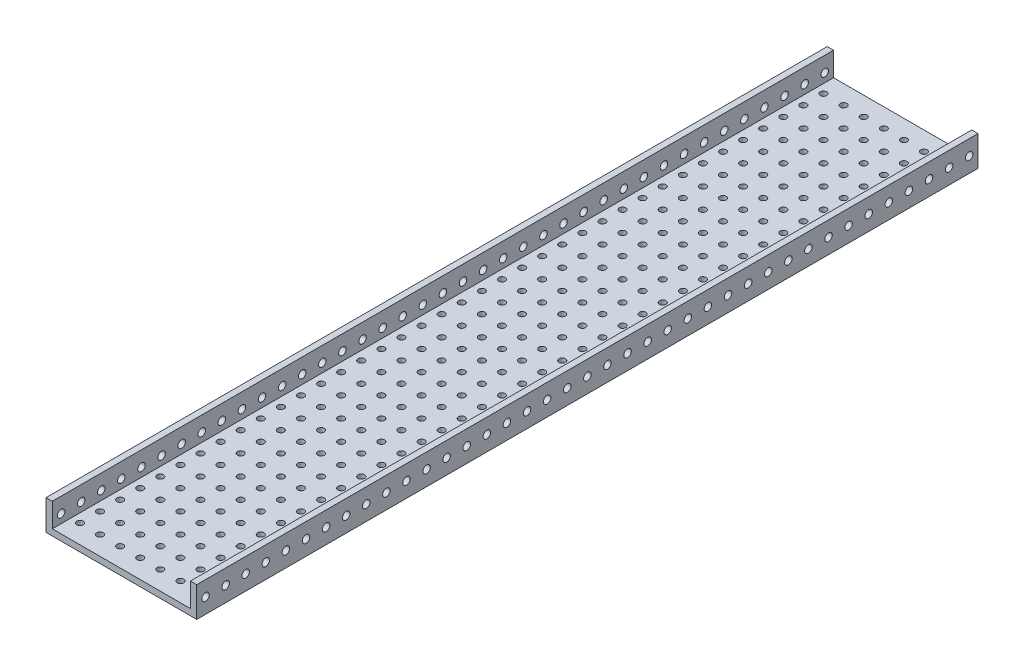
from build123d import *

# Parameters (mm, degrees)
EXTRUDE1_DEPTH        = 197.485
F_6_CLEARANCE_HOLE1_D = 3.7973
LPATTERN1_COUNT       = 39
LPATTERN1_PITCH       = 10.16
F_4_CLEARANCE_HOLE1_D = 3.2639
LPATTERN2_COUNT       = 4
LPATTERN2_PITCH       = 10.16
LPATTERN2_COL_COUNT   = 4
LPATTERN2_COL_PITCH   = 10.16
LPATTERN3_COUNT       = 38
LPATTERN3_PITCH       = 10.16
LPATTERN3_COPY_1_D    = 3.2639
LPATTERN3_COPY_2_D    = 3.2639
LPATTERN3_COPY_3_D    = 3.2639
LPATTERN3_COPY_4_D    = 3.2639
LPATTERN3_COPY_5_D    = 3.2639
LPATTERN3_COPY_6_D    = 3.2639
LPATTERN3_COPY_7_D    = 3.2639
LPATTERN3_COPY_8_D    = 3.2639
LPATTERN3_COPY_9_D    = 3.2639
LPATTERN3_COPY_10_D   = 3.2639
LPATTERN3_COPY_11_D   = 3.2639
LPATTERN3_COPY_12_D   = 3.2639
LPATTERN3_COPY_13_D   = 3.2639
LPATTERN3_COPY_14_D   = 3.2639
LPATTERN3_COPY_15_D   = 3.2639
LPATTERN3_COPY_16_D   = 3.2639
LPATTERN3_COPY_17_D   = 3.2639
LPATTERN3_COPY_18_D   = 3.2639
LPATTERN3_COPY_19_D   = 3.2639
LPATTERN3_COPY_20_D   = 3.2639
LPATTERN3_COPY_21_D   = 3.2639
LPATTERN3_COPY_22_D   = 3.2639
LPATTERN3_COPY_23_D   = 3.2639
LPATTERN3_COPY_24_D   = 3.2639
LPATTERN3_COPY_25_D   = 3.2639
LPATTERN3_COPY_26_D   = 3.2639
LPATTERN3_COPY_27_D   = 3.2639
LPATTERN3_COPY_28_D   = 3.2639
LPATTERN3_COPY_29_D   = 3.2639
LPATTERN3_COPY_30_D   = 3.2639
LPATTERN3_COPY_31_D   = 3.2639
LPATTERN3_COPY_32_D   = 3.2639
LPATTERN3_COPY_33_D   = 3.2639
LPATTERN3_COPY_34_D   = 3.2639
LPATTERN3_COPY_35_D   = 3.2639
LPATTERN3_COPY_36_D   = 3.2639
LPATTERN3_COPY_37_D   = 3.2639
LPATTERN3_COPY_38_D   = 3.2639
LPATTERN3_COPY_39_D   = 3.2639
LPATTERN3_COPY_40_D   = 3.2639
LPATTERN3_COPY_41_D   = 3.2639
LPATTERN3_COPY_42_D   = 3.2639
LPATTERN3_COPY_43_D   = 3.2639
LPATTERN3_COPY_44_D   = 3.2639
LPATTERN3_COPY_45_D   = 3.2639
LPATTERN3_COPY_46_D   = 3.2639
LPATTERN3_COPY_47_D   = 3.2639
LPATTERN3_COPY_48_D   = 3.2639
LPATTERN3_COPY_49_D   = 3.2639
LPATTERN3_COPY_50_D   = 3.2639
LPATTERN3_COPY_51_D   = 3.2639
LPATTERN3_COPY_52_D   = 3.2639
LPATTERN3_COPY_53_D   = 3.2639
LPATTERN3_COPY_54_D   = 3.2639
LPATTERN3_COPY_55_D   = 3.2639
LPATTERN3_COPY_56_D   = 3.2639
LPATTERN3_COPY_57_D   = 3.2639
LPATTERN3_COPY_58_D   = 3.2639
LPATTERN3_COPY_59_D   = 3.2639
LPATTERN3_COPY_60_D   = 3.2639
LPATTERN3_COPY_61_D   = 3.2639
LPATTERN3_COPY_62_D   = 3.2639
LPATTERN3_COPY_63_D   = 3.2639
LPATTERN3_COPY_64_D   = 3.2639
LPATTERN3_COPY_65_D   = 3.2639
LPATTERN3_COPY_66_D   = 3.2639
LPATTERN3_COPY_67_D   = 3.2639
LPATTERN3_COPY_68_D   = 3.2639
LPATTERN3_COPY_69_D   = 3.2639
LPATTERN3_COPY_70_D   = 3.2639
LPATTERN3_COPY_71_D   = 3.2639
LPATTERN3_COPY_72_D   = 3.2639
LPATTERN3_COPY_73_D   = 3.2639
LPATTERN3_COPY_74_D   = 3.2639
LPATTERN3_COPY_75_D   = 3.2639
LPATTERN3_COPY_76_D   = 3.2639
LPATTERN3_COPY_77_D   = 3.2639
LPATTERN3_COPY_78_D   = 3.2639
LPATTERN3_COPY_79_D   = 3.2639
LPATTERN3_COPY_80_D   = 3.2639
LPATTERN3_COPY_81_D   = 3.2639
LPATTERN3_COPY_82_D   = 3.2639
LPATTERN3_COPY_83_D   = 3.2639
LPATTERN3_COPY_84_D   = 3.2639
LPATTERN3_COPY_85_D   = 3.2639
LPATTERN3_COPY_86_D   = 3.2639
LPATTERN3_COPY_87_D   = 3.2639
LPATTERN3_COPY_88_D   = 3.2639
LPATTERN3_COPY_89_D   = 3.2639
LPATTERN3_COPY_90_D   = 3.2639
LPATTERN3_COPY_91_D   = 3.2639
LPATTERN3_COPY_92_D   = 3.2639
LPATTERN3_COPY_93_D   = 3.2639
LPATTERN3_COPY_94_D   = 3.2639
LPATTERN3_COPY_95_D   = 3.2639
LPATTERN3_COPY_96_D   = 3.2639
LPATTERN3_COPY_97_D   = 3.2639
LPATTERN3_COPY_98_D   = 3.2639
LPATTERN3_COPY_99_D   = 3.2639
LPATTERN3_COPY_100_D  = 3.2639
LPATTERN3_COPY_101_D  = 3.2639
LPATTERN3_COPY_102_D  = 3.2639
LPATTERN3_COPY_103_D  = 3.2639
LPATTERN3_COPY_104_D  = 3.2639
LPATTERN3_COPY_105_D  = 3.2639
LPATTERN3_COPY_106_D  = 3.2639
LPATTERN3_COPY_107_D  = 3.2639
LPATTERN3_COPY_108_D  = 3.2639
LPATTERN3_COPY_109_D  = 3.2639
LPATTERN3_COPY_110_D  = 3.2639
LPATTERN3_COPY_111_D  = 3.2639
LPATTERN3_COPY_112_D  = 3.2639
LPATTERN3_COPY_113_D  = 3.2639
LPATTERN3_COPY_114_D  = 3.2639
LPATTERN3_COPY_115_D  = 3.2639
LPATTERN3_COPY_116_D  = 3.2639
LPATTERN3_COPY_117_D  = 3.2639
LPATTERN3_COPY_118_D  = 3.2639
LPATTERN3_COPY_119_D  = 3.2639
LPATTERN3_COPY_120_D  = 3.2639
LPATTERN3_COPY_121_D  = 3.2639
LPATTERN3_COPY_122_D  = 3.2639
LPATTERN3_COPY_123_D  = 3.2639
LPATTERN3_COPY_124_D  = 3.2639
LPATTERN3_COPY_125_D  = 3.2639
LPATTERN3_COPY_126_D  = 3.2639
LPATTERN3_COPY_127_D  = 3.2639
LPATTERN3_COPY_128_D  = 3.2639
LPATTERN3_COPY_129_D  = 3.2639
LPATTERN3_COPY_130_D  = 3.2639
LPATTERN3_COPY_131_D  = 3.2639
LPATTERN3_COPY_132_D  = 3.2639
LPATTERN3_COPY_133_D  = 3.2639
LPATTERN3_COPY_134_D  = 3.2639
LPATTERN3_COPY_135_D  = 3.2639
LPATTERN3_COPY_136_D  = 3.2639
LPATTERN3_COPY_137_D  = 3.2639
LPATTERN3_COPY_138_D  = 3.2639
LPATTERN3_COPY_139_D  = 3.2639
LPATTERN3_COPY_140_D  = 3.2639
LPATTERN3_COPY_141_D  = 3.2639
LPATTERN3_COPY_142_D  = 3.2639
LPATTERN3_COPY_143_D  = 3.2639
LPATTERN3_COPY_144_D  = 3.2639
LPATTERN3_COPY_145_D  = 3.2639
LPATTERN3_COPY_146_D  = 3.2639
LPATTERN3_COPY_147_D  = 3.2639
LPATTERN3_COPY_148_D  = 3.2639
LPATTERN3_COPY_149_D  = 3.2639
LPATTERN3_COPY_150_D  = 3.2639
LPATTERN3_COPY_151_D  = 3.2639
LPATTERN3_COPY_152_D  = 3.2639
LPATTERN3_COPY_153_D  = 3.2639
LPATTERN3_COPY_154_D  = 3.2639
LPATTERN3_COPY_155_D  = 3.2639
LPATTERN3_COPY_156_D  = 3.2639
LPATTERN3_COPY_157_D  = 3.2639
LPATTERN3_COPY_158_D  = 3.2639
LPATTERN3_COPY_159_D  = 3.2639
LPATTERN3_COPY_160_D  = 3.2639
LPATTERN3_COPY_161_D  = 3.2639
LPATTERN3_COPY_162_D  = 3.2639
LPATTERN3_COPY_163_D  = 3.2639
LPATTERN3_COPY_164_D  = 3.2639
LPATTERN3_COPY_165_D  = 3.2639
LPATTERN3_COPY_166_D  = 3.2639
LPATTERN3_COPY_167_D  = 3.2639
LPATTERN3_COPY_168_D  = 3.2639
LPATTERN3_COPY_169_D  = 3.2639
LPATTERN3_COPY_170_D  = 3.2639
LPATTERN3_COPY_171_D  = 3.2639
LPATTERN3_COPY_172_D  = 3.2639
LPATTERN3_COPY_173_D  = 3.2639
LPATTERN3_COPY_174_D  = 3.2639
LPATTERN3_COPY_175_D  = 3.2639
LPATTERN3_COPY_176_D  = 3.2639
LPATTERN3_COPY_177_D  = 3.2639
LPATTERN3_COPY_178_D  = 3.2639
LPATTERN3_COPY_179_D  = 3.2639
LPATTERN3_COPY_180_D  = 3.2639
LPATTERN3_COPY_181_D  = 3.2639
LPATTERN3_COPY_182_D  = 3.2639
LPATTERN3_COPY_183_D  = 3.2639
LPATTERN3_COPY_184_D  = 3.2639
LPATTERN3_COPY_185_D  = 3.2639
LPATTERN3_COPY_186_D  = 3.2639
LPATTERN3_COPY_187_D  = 3.2639
LPATTERN3_COPY_188_D  = 3.2639
LPATTERN3_COPY_189_D  = 3.2639
LPATTERN3_COPY_190_D  = 3.2639
LPATTERN3_COPY_191_D  = 3.2639
LPATTERN3_COPY_192_D  = 3.2639
LPATTERN3_COPY_193_D  = 3.2639
LPATTERN3_COPY_194_D  = 3.2639
LPATTERN3_COPY_195_D  = 3.2639
LPATTERN3_COPY_196_D  = 3.2639
LPATTERN3_COPY_197_D  = 3.2639
LPATTERN3_COPY_198_D  = 3.2639
LPATTERN3_COPY_199_D  = 3.2639
LPATTERN3_COPY_200_D  = 3.2639
LPATTERN3_COPY_201_D  = 3.2639
LPATTERN3_COPY_202_D  = 3.2639
LPATTERN3_COPY_203_D  = 3.2639
LPATTERN3_COPY_204_D  = 3.2639
LPATTERN3_COPY_205_D  = 3.2639
LPATTERN3_COPY_206_D  = 3.2639
LPATTERN3_COPY_207_D  = 3.2639
LPATTERN3_COPY_208_D  = 3.2639
LPATTERN3_COPY_209_D  = 3.2639
LPATTERN3_COPY_210_D  = 3.2639
LPATTERN3_COPY_211_D  = 3.2639
LPATTERN3_COPY_212_D  = 3.2639
LPATTERN3_COPY_213_D  = 3.2639
LPATTERN3_COPY_214_D  = 3.2639
LPATTERN3_COPY_215_D  = 3.2639
LPATTERN3_COPY_216_D  = 3.2639
LPATTERN3_COPY_217_D  = 3.2639
LPATTERN3_COPY_218_D  = 3.2639
LPATTERN3_COPY_219_D  = 3.2639
LPATTERN3_COPY_220_D  = 3.2639
LPATTERN3_COPY_221_D  = 3.2639
LPATTERN3_COPY_222_D  = 3.2639


with BuildPart() as part:
    # Sketch1 → Extrude1 (new, symmetric)
    with BuildSketch(Plane.XY):
        Polygon((0, 0), (38.1, 0), (38.1, 15.24), (34.925, 15.24), (34.925, 3.175), (-34.925, 3.175), (-34.925, 15.24), (-38.1, 15.24), (-38.1, 0), align=None)
    extrude(amount=EXTRUDE1_DEPTH, both=True)

    # #6 Clearance Hole1 (through all)
    with Locations(Plane(origin=(38.1, 7.62, 193.04), x_dir=(0, 0, 1), z_dir=(1, 0, 0))):
        with Locations((0, 0)):
            f_6_clearance_hole1 = Hole(F_6_CLEARANCE_HOLE1_D / 2)

    # LPattern1: #6 Clearance Hole1 ×39
    with Locations(*[(0, 0, -i * LPATTERN1_PITCH) for i in range(1, LPATTERN1_COUNT)]):
        add(f_6_clearance_hole1, mode=Mode.SUBTRACT)

    # #4 Clearance Hole1 (through all)
    with Locations(Plane(origin=(0, 0, 187.96), x_dir=(0, 0, -1), z_dir=(0, -1, 0))):
        with Locations((0, 0)):
            f_4_clearance_hole1 = Hole(F_4_CLEARANCE_HOLE1_D / 2)

    # LPattern2: #4 Clearance Hole1 ×4
    with Locations(*[(i * LPATTERN2_PITCH, 0, 0) for i in range(1, LPATTERN2_COUNT)]):
        add(f_4_clearance_hole1, mode=Mode.SUBTRACT)

    # LPattern2 col: #4 Clearance Hole1 ×4
    with Locations(*[(-i * LPATTERN2_COL_PITCH, 0, 0) for i in range(1, LPATTERN2_COL_COUNT)]):
        add(f_4_clearance_hole1, mode=Mode.SUBTRACT)

    # LPattern3: #4 Clearance Hole1 ×38
    with Locations(*[(0, 0, -i * LPATTERN3_PITCH) for i in range(1, LPATTERN3_COUNT)]):
        add(f_4_clearance_hole1, mode=Mode.SUBTRACT)

    # LPattern3 copy 1 (through all)
    with Locations(Plane(origin=(10.16, 0, 177.8), x_dir=(0, 0, -1), z_dir=(0, -1, 0))):
        with Locations((0, 0)):
            Hole(LPATTERN3_COPY_1_D / 2)

    # LPattern3 copy 2 (through all)
    with Locations(Plane(origin=(10.16, 0, 167.64), x_dir=(0, 0, -1), z_dir=(0, -1, 0))):
        with Locations((0, 0)):
            Hole(LPATTERN3_COPY_2_D / 2)

    # LPattern3 copy 3 (through all)
    with Locations(Plane(origin=(10.16, 0, 157.48), x_dir=(0, 0, -1), z_dir=(0, -1, 0))):
        with Locations((0, 0)):
            Hole(LPATTERN3_COPY_3_D / 2)

    # LPattern3 copy 4 (through all)
    with Locations(Plane(origin=(10.16, 0, 147.32), x_dir=(0, 0, -1), z_dir=(0, -1, 0))):
        with Locations((0, 0)):
            Hole(LPATTERN3_COPY_4_D / 2)

    # LPattern3 copy 5 (through all)
    with Locations(Plane(origin=(10.16, 0, 137.16), x_dir=(0, 0, -1), z_dir=(0, -1, 0))):
        with Locations((0, 0)):
            Hole(LPATTERN3_COPY_5_D / 2)

    # LPattern3 copy 6 (through all)
    with Locations(Plane(origin=(10.16, 0, 127), x_dir=(0, 0, -1), z_dir=(0, -1, 0))):
        with Locations((0, 0)):
            Hole(LPATTERN3_COPY_6_D / 2)

    # LPattern3 copy 7 (through all)
    with Locations(Plane(origin=(10.16, 0, 116.84), x_dir=(0, 0, -1), z_dir=(0, -1, 0))):
        with Locations((0, 0)):
            Hole(LPATTERN3_COPY_7_D / 2)

    # LPattern3 copy 8 (through all)
    with Locations(Plane(origin=(10.16, 0, 106.68), x_dir=(0, 0, -1), z_dir=(0, -1, 0))):
        with Locations((0, 0)):
            Hole(LPATTERN3_COPY_8_D / 2)

    # LPattern3 copy 9 (through all)
    with Locations(Plane(origin=(10.16, 0, 96.52), x_dir=(0, 0, -1), z_dir=(0, -1, 0))):
        with Locations((0, 0)):
            Hole(LPATTERN3_COPY_9_D / 2)

    # LPattern3 copy 10 (through all)
    with Locations(Plane(origin=(10.16, 0, 86.36), x_dir=(0, 0, -1), z_dir=(0, -1, 0))):
        with Locations((0, 0)):
            Hole(LPATTERN3_COPY_10_D / 2)

    # LPattern3 copy 11 (through all)
    with Locations(Plane(origin=(10.16, 0, 76.2), x_dir=(0, 0, -1), z_dir=(0, -1, 0))):
        with Locations((0, 0)):
            Hole(LPATTERN3_COPY_11_D / 2)

    # LPattern3 copy 12 (through all)
    with Locations(Plane(origin=(10.16, 0, 66.04), x_dir=(0, 0, -1), z_dir=(0, -1, 0))):
        with Locations((0, 0)):
            Hole(LPATTERN3_COPY_12_D / 2)

    # LPattern3 copy 13 (through all)
    with Locations(Plane(origin=(10.16, 0, 55.88), x_dir=(0, 0, -1), z_dir=(0, -1, 0))):
        with Locations((0, 0)):
            Hole(LPATTERN3_COPY_13_D / 2)

    # LPattern3 copy 14 (through all)
    with Locations(Plane(origin=(10.16, 0, 45.72), x_dir=(0, 0, -1), z_dir=(0, -1, 0))):
        with Locations((0, 0)):
            Hole(LPATTERN3_COPY_14_D / 2)

    # LPattern3 copy 15 (through all)
    with Locations(Plane(origin=(10.16, 0, 35.56), x_dir=(0, 0, -1), z_dir=(0, -1, 0))):
        with Locations((0, 0)):
            Hole(LPATTERN3_COPY_15_D / 2)

    # LPattern3 copy 16 (through all)
    with Locations(Plane(origin=(10.16, 0, 25.4), x_dir=(0, 0, -1), z_dir=(0, -1, 0))):
        with Locations((0, 0)):
            Hole(LPATTERN3_COPY_16_D / 2)

    # LPattern3 copy 17 (through all)
    with Locations(Plane(origin=(10.16, 0, 15.24), x_dir=(0, 0, -1), z_dir=(0, -1, 0))):
        with Locations((0, 0)):
            Hole(LPATTERN3_COPY_17_D / 2)

    # LPattern3 copy 18 (through all)
    with Locations(Plane(origin=(10.16, 0, 5.08), x_dir=(0, 0, -1), z_dir=(0, -1, 0))):
        with Locations((0, 0)):
            Hole(LPATTERN3_COPY_18_D / 2)

    # LPattern3 copy 19 (through all)
    with Locations(Plane(origin=(10.16, 0, -5.08), x_dir=(0, 0, -1), z_dir=(0, -1, 0))):
        with Locations((0, 0)):
            Hole(LPATTERN3_COPY_19_D / 2)

    # LPattern3 copy 20 (through all)
    with Locations(Plane(origin=(10.16, 0, -15.24), x_dir=(0, 0, -1), z_dir=(0, -1, 0))):
        with Locations((0, 0)):
            Hole(LPATTERN3_COPY_20_D / 2)

    # LPattern3 copy 21 (through all)
    with Locations(Plane(origin=(10.16, 0, -25.4), x_dir=(0, 0, -1), z_dir=(0, -1, 0))):
        with Locations((0, 0)):
            Hole(LPATTERN3_COPY_21_D / 2)

    # LPattern3 copy 22 (through all)
    with Locations(Plane(origin=(10.16, 0, -35.56), x_dir=(0, 0, -1), z_dir=(0, -1, 0))):
        with Locations((0, 0)):
            Hole(LPATTERN3_COPY_22_D / 2)

    # LPattern3 copy 23 (through all)
    with Locations(Plane(origin=(10.16, 0, -45.72), x_dir=(0, 0, -1), z_dir=(0, -1, 0))):
        with Locations((0, 0)):
            Hole(LPATTERN3_COPY_23_D / 2)

    # LPattern3 copy 24 (through all)
    with Locations(Plane(origin=(10.16, 0, -55.88), x_dir=(0, 0, -1), z_dir=(0, -1, 0))):
        with Locations((0, 0)):
            Hole(LPATTERN3_COPY_24_D / 2)

    # LPattern3 copy 25 (through all)
    with Locations(Plane(origin=(10.16, 0, -66.04), x_dir=(0, 0, -1), z_dir=(0, -1, 0))):
        with Locations((0, 0)):
            Hole(LPATTERN3_COPY_25_D / 2)

    # LPattern3 copy 26 (through all)
    with Locations(Plane(origin=(10.16, 0, -76.2), x_dir=(0, 0, -1), z_dir=(0, -1, 0))):
        with Locations((0, 0)):
            Hole(LPATTERN3_COPY_26_D / 2)

    # LPattern3 copy 27 (through all)
    with Locations(Plane(origin=(10.16, 0, -86.36), x_dir=(0, 0, -1), z_dir=(0, -1, 0))):
        with Locations((0, 0)):
            Hole(LPATTERN3_COPY_27_D / 2)

    # LPattern3 copy 28 (through all)
    with Locations(Plane(origin=(10.16, 0, -96.52), x_dir=(0, 0, -1), z_dir=(0, -1, 0))):
        with Locations((0, 0)):
            Hole(LPATTERN3_COPY_28_D / 2)

    # LPattern3 copy 29 (through all)
    with Locations(Plane(origin=(10.16, 0, -106.68), x_dir=(0, 0, -1), z_dir=(0, -1, 0))):
        with Locations((0, 0)):
            Hole(LPATTERN3_COPY_29_D / 2)

    # LPattern3 copy 30 (through all)
    with Locations(Plane(origin=(10.16, 0, -116.84), x_dir=(0, 0, -1), z_dir=(0, -1, 0))):
        with Locations((0, 0)):
            Hole(LPATTERN3_COPY_30_D / 2)

    # LPattern3 copy 31 (through all)
    with Locations(Plane(origin=(10.16, 0, -127), x_dir=(0, 0, -1), z_dir=(0, -1, 0))):
        with Locations((0, 0)):
            Hole(LPATTERN3_COPY_31_D / 2)

    # LPattern3 copy 32 (through all)
    with Locations(Plane(origin=(10.16, 0, -137.16), x_dir=(0, 0, -1), z_dir=(0, -1, 0))):
        with Locations((0, 0)):
            Hole(LPATTERN3_COPY_32_D / 2)

    # LPattern3 copy 33 (through all)
    with Locations(Plane(origin=(10.16, 0, -147.32), x_dir=(0, 0, -1), z_dir=(0, -1, 0))):
        with Locations((0, 0)):
            Hole(LPATTERN3_COPY_33_D / 2)

    # LPattern3 copy 34 (through all)
    with Locations(Plane(origin=(10.16, 0, -157.48), x_dir=(0, 0, -1), z_dir=(0, -1, 0))):
        with Locations((0, 0)):
            Hole(LPATTERN3_COPY_34_D / 2)

    # LPattern3 copy 35 (through all)
    with Locations(Plane(origin=(10.16, 0, -167.64), x_dir=(0, 0, -1), z_dir=(0, -1, 0))):
        with Locations((0, 0)):
            Hole(LPATTERN3_COPY_35_D / 2)

    # LPattern3 copy 36 (through all)
    with Locations(Plane(origin=(10.16, 0, -177.8), x_dir=(0, 0, -1), z_dir=(0, -1, 0))):
        with Locations((0, 0)):
            Hole(LPATTERN3_COPY_36_D / 2)

    # LPattern3 copy 37 (through all)
    with Locations(Plane(origin=(10.16, 0, -187.96), x_dir=(0, 0, -1), z_dir=(0, -1, 0))):
        with Locations((0, 0)):
            Hole(LPATTERN3_COPY_37_D / 2)

    # LPattern3 copy 38 (through all)
    with Locations(Plane(origin=(20.32, 0, 177.8), x_dir=(0, 0, -1), z_dir=(0, -1, 0))):
        with Locations((0, 0)):
            Hole(LPATTERN3_COPY_38_D / 2)

    # LPattern3 copy 39 (through all)
    with Locations(Plane(origin=(20.32, 0, 167.64), x_dir=(0, 0, -1), z_dir=(0, -1, 0))):
        with Locations((0, 0)):
            Hole(LPATTERN3_COPY_39_D / 2)

    # LPattern3 copy 40 (through all)
    with Locations(Plane(origin=(20.32, 0, 157.48), x_dir=(0, 0, -1), z_dir=(0, -1, 0))):
        with Locations((0, 0)):
            Hole(LPATTERN3_COPY_40_D / 2)

    # LPattern3 copy 41 (through all)
    with Locations(Plane(origin=(20.32, 0, 147.32), x_dir=(0, 0, -1), z_dir=(0, -1, 0))):
        with Locations((0, 0)):
            Hole(LPATTERN3_COPY_41_D / 2)

    # LPattern3 copy 42 (through all)
    with Locations(Plane(origin=(20.32, 0, 137.16), x_dir=(0, 0, -1), z_dir=(0, -1, 0))):
        with Locations((0, 0)):
            Hole(LPATTERN3_COPY_42_D / 2)

    # LPattern3 copy 43 (through all)
    with Locations(Plane(origin=(20.32, 0, 127), x_dir=(0, 0, -1), z_dir=(0, -1, 0))):
        with Locations((0, 0)):
            Hole(LPATTERN3_COPY_43_D / 2)

    # LPattern3 copy 44 (through all)
    with Locations(Plane(origin=(20.32, 0, 116.84), x_dir=(0, 0, -1), z_dir=(0, -1, 0))):
        with Locations((0, 0)):
            Hole(LPATTERN3_COPY_44_D / 2)

    # LPattern3 copy 45 (through all)
    with Locations(Plane(origin=(20.32, 0, 106.68), x_dir=(0, 0, -1), z_dir=(0, -1, 0))):
        with Locations((0, 0)):
            Hole(LPATTERN3_COPY_45_D / 2)

    # LPattern3 copy 46 (through all)
    with Locations(Plane(origin=(20.32, 0, 96.52), x_dir=(0, 0, -1), z_dir=(0, -1, 0))):
        with Locations((0, 0)):
            Hole(LPATTERN3_COPY_46_D / 2)

    # LPattern3 copy 47 (through all)
    with Locations(Plane(origin=(20.32, 0, 86.36), x_dir=(0, 0, -1), z_dir=(0, -1, 0))):
        with Locations((0, 0)):
            Hole(LPATTERN3_COPY_47_D / 2)

    # LPattern3 copy 48 (through all)
    with Locations(Plane(origin=(20.32, 0, 76.2), x_dir=(0, 0, -1), z_dir=(0, -1, 0))):
        with Locations((0, 0)):
            Hole(LPATTERN3_COPY_48_D / 2)

    # LPattern3 copy 49 (through all)
    with Locations(Plane(origin=(20.32, 0, 66.04), x_dir=(0, 0, -1), z_dir=(0, -1, 0))):
        with Locations((0, 0)):
            Hole(LPATTERN3_COPY_49_D / 2)

    # LPattern3 copy 50 (through all)
    with Locations(Plane(origin=(20.32, 0, 55.88), x_dir=(0, 0, -1), z_dir=(0, -1, 0))):
        with Locations((0, 0)):
            Hole(LPATTERN3_COPY_50_D / 2)

    # LPattern3 copy 51 (through all)
    with Locations(Plane(origin=(20.32, 0, 45.72), x_dir=(0, 0, -1), z_dir=(0, -1, 0))):
        with Locations((0, 0)):
            Hole(LPATTERN3_COPY_51_D / 2)

    # LPattern3 copy 52 (through all)
    with Locations(Plane(origin=(20.32, 0, 35.56), x_dir=(0, 0, -1), z_dir=(0, -1, 0))):
        with Locations((0, 0)):
            Hole(LPATTERN3_COPY_52_D / 2)

    # LPattern3 copy 53 (through all)
    with Locations(Plane(origin=(20.32, 0, 25.4), x_dir=(0, 0, -1), z_dir=(0, -1, 0))):
        with Locations((0, 0)):
            Hole(LPATTERN3_COPY_53_D / 2)

    # LPattern3 copy 54 (through all)
    with Locations(Plane(origin=(20.32, 0, 15.24), x_dir=(0, 0, -1), z_dir=(0, -1, 0))):
        with Locations((0, 0)):
            Hole(LPATTERN3_COPY_54_D / 2)

    # LPattern3 copy 55 (through all)
    with Locations(Plane(origin=(20.32, 0, 5.08), x_dir=(0, 0, -1), z_dir=(0, -1, 0))):
        with Locations((0, 0)):
            Hole(LPATTERN3_COPY_55_D / 2)

    # LPattern3 copy 56 (through all)
    with Locations(Plane(origin=(20.32, 0, -5.08), x_dir=(0, 0, -1), z_dir=(0, -1, 0))):
        with Locations((0, 0)):
            Hole(LPATTERN3_COPY_56_D / 2)

    # LPattern3 copy 57 (through all)
    with Locations(Plane(origin=(20.32, 0, -15.24), x_dir=(0, 0, -1), z_dir=(0, -1, 0))):
        with Locations((0, 0)):
            Hole(LPATTERN3_COPY_57_D / 2)

    # LPattern3 copy 58 (through all)
    with Locations(Plane(origin=(20.32, 0, -25.4), x_dir=(0, 0, -1), z_dir=(0, -1, 0))):
        with Locations((0, 0)):
            Hole(LPATTERN3_COPY_58_D / 2)

    # LPattern3 copy 59 (through all)
    with Locations(Plane(origin=(20.32, 0, -35.56), x_dir=(0, 0, -1), z_dir=(0, -1, 0))):
        with Locations((0, 0)):
            Hole(LPATTERN3_COPY_59_D / 2)

    # LPattern3 copy 60 (through all)
    with Locations(Plane(origin=(20.32, 0, -45.72), x_dir=(0, 0, -1), z_dir=(0, -1, 0))):
        with Locations((0, 0)):
            Hole(LPATTERN3_COPY_60_D / 2)

    # LPattern3 copy 61 (through all)
    with Locations(Plane(origin=(20.32, 0, -55.88), x_dir=(0, 0, -1), z_dir=(0, -1, 0))):
        with Locations((0, 0)):
            Hole(LPATTERN3_COPY_61_D / 2)

    # LPattern3 copy 62 (through all)
    with Locations(Plane(origin=(20.32, 0, -66.04), x_dir=(0, 0, -1), z_dir=(0, -1, 0))):
        with Locations((0, 0)):
            Hole(LPATTERN3_COPY_62_D / 2)

    # LPattern3 copy 63 (through all)
    with Locations(Plane(origin=(20.32, 0, -76.2), x_dir=(0, 0, -1), z_dir=(0, -1, 0))):
        with Locations((0, 0)):
            Hole(LPATTERN3_COPY_63_D / 2)

    # LPattern3 copy 64 (through all)
    with Locations(Plane(origin=(20.32, 0, -86.36), x_dir=(0, 0, -1), z_dir=(0, -1, 0))):
        with Locations((0, 0)):
            Hole(LPATTERN3_COPY_64_D / 2)

    # LPattern3 copy 65 (through all)
    with Locations(Plane(origin=(20.32, 0, -96.52), x_dir=(0, 0, -1), z_dir=(0, -1, 0))):
        with Locations((0, 0)):
            Hole(LPATTERN3_COPY_65_D / 2)

    # LPattern3 copy 66 (through all)
    with Locations(Plane(origin=(20.32, 0, -106.68), x_dir=(0, 0, -1), z_dir=(0, -1, 0))):
        with Locations((0, 0)):
            Hole(LPATTERN3_COPY_66_D / 2)

    # LPattern3 copy 67 (through all)
    with Locations(Plane(origin=(20.32, 0, -116.84), x_dir=(0, 0, -1), z_dir=(0, -1, 0))):
        with Locations((0, 0)):
            Hole(LPATTERN3_COPY_67_D / 2)

    # LPattern3 copy 68 (through all)
    with Locations(Plane(origin=(20.32, 0, -127), x_dir=(0, 0, -1), z_dir=(0, -1, 0))):
        with Locations((0, 0)):
            Hole(LPATTERN3_COPY_68_D / 2)

    # LPattern3 copy 69 (through all)
    with Locations(Plane(origin=(20.32, 0, -137.16), x_dir=(0, 0, -1), z_dir=(0, -1, 0))):
        with Locations((0, 0)):
            Hole(LPATTERN3_COPY_69_D / 2)

    # LPattern3 copy 70 (through all)
    with Locations(Plane(origin=(20.32, 0, -147.32), x_dir=(0, 0, -1), z_dir=(0, -1, 0))):
        with Locations((0, 0)):
            Hole(LPATTERN3_COPY_70_D / 2)

    # LPattern3 copy 71 (through all)
    with Locations(Plane(origin=(20.32, 0, -157.48), x_dir=(0, 0, -1), z_dir=(0, -1, 0))):
        with Locations((0, 0)):
            Hole(LPATTERN3_COPY_71_D / 2)

    # LPattern3 copy 72 (through all)
    with Locations(Plane(origin=(20.32, 0, -167.64), x_dir=(0, 0, -1), z_dir=(0, -1, 0))):
        with Locations((0, 0)):
            Hole(LPATTERN3_COPY_72_D / 2)

    # LPattern3 copy 73 (through all)
    with Locations(Plane(origin=(20.32, 0, -177.8), x_dir=(0, 0, -1), z_dir=(0, -1, 0))):
        with Locations((0, 0)):
            Hole(LPATTERN3_COPY_73_D / 2)

    # LPattern3 copy 74 (through all)
    with Locations(Plane(origin=(20.32, 0, -187.96), x_dir=(0, 0, -1), z_dir=(0, -1, 0))):
        with Locations((0, 0)):
            Hole(LPATTERN3_COPY_74_D / 2)

    # LPattern3 copy 75 (through all)
    with Locations(Plane(origin=(30.48, 0, 177.8), x_dir=(0, 0, -1), z_dir=(0, -1, 0))):
        with Locations((0, 0)):
            Hole(LPATTERN3_COPY_75_D / 2)

    # LPattern3 copy 76 (through all)
    with Locations(Plane(origin=(30.48, 0, 167.64), x_dir=(0, 0, -1), z_dir=(0, -1, 0))):
        with Locations((0, 0)):
            Hole(LPATTERN3_COPY_76_D / 2)

    # LPattern3 copy 77 (through all)
    with Locations(Plane(origin=(30.48, 0, 157.48), x_dir=(0, 0, -1), z_dir=(0, -1, 0))):
        with Locations((0, 0)):
            Hole(LPATTERN3_COPY_77_D / 2)

    # LPattern3 copy 78 (through all)
    with Locations(Plane(origin=(30.48, 0, 147.32), x_dir=(0, 0, -1), z_dir=(0, -1, 0))):
        with Locations((0, 0)):
            Hole(LPATTERN3_COPY_78_D / 2)

    # LPattern3 copy 79 (through all)
    with Locations(Plane(origin=(30.48, 0, 137.16), x_dir=(0, 0, -1), z_dir=(0, -1, 0))):
        with Locations((0, 0)):
            Hole(LPATTERN3_COPY_79_D / 2)

    # LPattern3 copy 80 (through all)
    with Locations(Plane(origin=(30.48, 0, 127), x_dir=(0, 0, -1), z_dir=(0, -1, 0))):
        with Locations((0, 0)):
            Hole(LPATTERN3_COPY_80_D / 2)

    # LPattern3 copy 81 (through all)
    with Locations(Plane(origin=(30.48, 0, 116.84), x_dir=(0, 0, -1), z_dir=(0, -1, 0))):
        with Locations((0, 0)):
            Hole(LPATTERN3_COPY_81_D / 2)

    # LPattern3 copy 82 (through all)
    with Locations(Plane(origin=(30.48, 0, 106.68), x_dir=(0, 0, -1), z_dir=(0, -1, 0))):
        with Locations((0, 0)):
            Hole(LPATTERN3_COPY_82_D / 2)

    # LPattern3 copy 83 (through all)
    with Locations(Plane(origin=(30.48, 0, 96.52), x_dir=(0, 0, -1), z_dir=(0, -1, 0))):
        with Locations((0, 0)):
            Hole(LPATTERN3_COPY_83_D / 2)

    # LPattern3 copy 84 (through all)
    with Locations(Plane(origin=(30.48, 0, 86.36), x_dir=(0, 0, -1), z_dir=(0, -1, 0))):
        with Locations((0, 0)):
            Hole(LPATTERN3_COPY_84_D / 2)

    # LPattern3 copy 85 (through all)
    with Locations(Plane(origin=(30.48, 0, 76.2), x_dir=(0, 0, -1), z_dir=(0, -1, 0))):
        with Locations((0, 0)):
            Hole(LPATTERN3_COPY_85_D / 2)

    # LPattern3 copy 86 (through all)
    with Locations(Plane(origin=(30.48, 0, 66.04), x_dir=(0, 0, -1), z_dir=(0, -1, 0))):
        with Locations((0, 0)):
            Hole(LPATTERN3_COPY_86_D / 2)

    # LPattern3 copy 87 (through all)
    with Locations(Plane(origin=(30.48, 0, 55.88), x_dir=(0, 0, -1), z_dir=(0, -1, 0))):
        with Locations((0, 0)):
            Hole(LPATTERN3_COPY_87_D / 2)

    # LPattern3 copy 88 (through all)
    with Locations(Plane(origin=(30.48, 0, 45.72), x_dir=(0, 0, -1), z_dir=(0, -1, 0))):
        with Locations((0, 0)):
            Hole(LPATTERN3_COPY_88_D / 2)

    # LPattern3 copy 89 (through all)
    with Locations(Plane(origin=(30.48, 0, 35.56), x_dir=(0, 0, -1), z_dir=(0, -1, 0))):
        with Locations((0, 0)):
            Hole(LPATTERN3_COPY_89_D / 2)

    # LPattern3 copy 90 (through all)
    with Locations(Plane(origin=(30.48, 0, 25.4), x_dir=(0, 0, -1), z_dir=(0, -1, 0))):
        with Locations((0, 0)):
            Hole(LPATTERN3_COPY_90_D / 2)

    # LPattern3 copy 91 (through all)
    with Locations(Plane(origin=(30.48, 0, 15.24), x_dir=(0, 0, -1), z_dir=(0, -1, 0))):
        with Locations((0, 0)):
            Hole(LPATTERN3_COPY_91_D / 2)

    # LPattern3 copy 92 (through all)
    with Locations(Plane(origin=(30.48, 0, 5.08), x_dir=(0, 0, -1), z_dir=(0, -1, 0))):
        with Locations((0, 0)):
            Hole(LPATTERN3_COPY_92_D / 2)

    # LPattern3 copy 93 (through all)
    with Locations(Plane(origin=(30.48, 0, -5.08), x_dir=(0, 0, -1), z_dir=(0, -1, 0))):
        with Locations((0, 0)):
            Hole(LPATTERN3_COPY_93_D / 2)

    # LPattern3 copy 94 (through all)
    with Locations(Plane(origin=(30.48, 0, -15.24), x_dir=(0, 0, -1), z_dir=(0, -1, 0))):
        with Locations((0, 0)):
            Hole(LPATTERN3_COPY_94_D / 2)

    # LPattern3 copy 95 (through all)
    with Locations(Plane(origin=(30.48, 0, -25.4), x_dir=(0, 0, -1), z_dir=(0, -1, 0))):
        with Locations((0, 0)):
            Hole(LPATTERN3_COPY_95_D / 2)

    # LPattern3 copy 96 (through all)
    with Locations(Plane(origin=(30.48, 0, -35.56), x_dir=(0, 0, -1), z_dir=(0, -1, 0))):
        with Locations((0, 0)):
            Hole(LPATTERN3_COPY_96_D / 2)

    # LPattern3 copy 97 (through all)
    with Locations(Plane(origin=(30.48, 0, -45.72), x_dir=(0, 0, -1), z_dir=(0, -1, 0))):
        with Locations((0, 0)):
            Hole(LPATTERN3_COPY_97_D / 2)

    # LPattern3 copy 98 (through all)
    with Locations(Plane(origin=(30.48, 0, -55.88), x_dir=(0, 0, -1), z_dir=(0, -1, 0))):
        with Locations((0, 0)):
            Hole(LPATTERN3_COPY_98_D / 2)

    # LPattern3 copy 99 (through all)
    with Locations(Plane(origin=(30.48, 0, -66.04), x_dir=(0, 0, -1), z_dir=(0, -1, 0))):
        with Locations((0, 0)):
            Hole(LPATTERN3_COPY_99_D / 2)

    # LPattern3 copy 100 (through all)
    with Locations(Plane(origin=(30.48, 0, -76.2), x_dir=(0, 0, -1), z_dir=(0, -1, 0))):
        with Locations((0, 0)):
            Hole(LPATTERN3_COPY_100_D / 2)

    # LPattern3 copy 101 (through all)
    with Locations(Plane(origin=(30.48, 0, -86.36), x_dir=(0, 0, -1), z_dir=(0, -1, 0))):
        with Locations((0, 0)):
            Hole(LPATTERN3_COPY_101_D / 2)

    # LPattern3 copy 102 (through all)
    with Locations(Plane(origin=(30.48, 0, -96.52), x_dir=(0, 0, -1), z_dir=(0, -1, 0))):
        with Locations((0, 0)):
            Hole(LPATTERN3_COPY_102_D / 2)

    # LPattern3 copy 103 (through all)
    with Locations(Plane(origin=(30.48, 0, -106.68), x_dir=(0, 0, -1), z_dir=(0, -1, 0))):
        with Locations((0, 0)):
            Hole(LPATTERN3_COPY_103_D / 2)

    # LPattern3 copy 104 (through all)
    with Locations(Plane(origin=(30.48, 0, -116.84), x_dir=(0, 0, -1), z_dir=(0, -1, 0))):
        with Locations((0, 0)):
            Hole(LPATTERN3_COPY_104_D / 2)

    # LPattern3 copy 105 (through all)
    with Locations(Plane(origin=(30.48, 0, -127), x_dir=(0, 0, -1), z_dir=(0, -1, 0))):
        with Locations((0, 0)):
            Hole(LPATTERN3_COPY_105_D / 2)

    # LPattern3 copy 106 (through all)
    with Locations(Plane(origin=(30.48, 0, -137.16), x_dir=(0, 0, -1), z_dir=(0, -1, 0))):
        with Locations((0, 0)):
            Hole(LPATTERN3_COPY_106_D / 2)

    # LPattern3 copy 107 (through all)
    with Locations(Plane(origin=(30.48, 0, -147.32), x_dir=(0, 0, -1), z_dir=(0, -1, 0))):
        with Locations((0, 0)):
            Hole(LPATTERN3_COPY_107_D / 2)

    # LPattern3 copy 108 (through all)
    with Locations(Plane(origin=(30.48, 0, -157.48), x_dir=(0, 0, -1), z_dir=(0, -1, 0))):
        with Locations((0, 0)):
            Hole(LPATTERN3_COPY_108_D / 2)

    # LPattern3 copy 109 (through all)
    with Locations(Plane(origin=(30.48, 0, -167.64), x_dir=(0, 0, -1), z_dir=(0, -1, 0))):
        with Locations((0, 0)):
            Hole(LPATTERN3_COPY_109_D / 2)

    # LPattern3 copy 110 (through all)
    with Locations(Plane(origin=(30.48, 0, -177.8), x_dir=(0, 0, -1), z_dir=(0, -1, 0))):
        with Locations((0, 0)):
            Hole(LPATTERN3_COPY_110_D / 2)

    # LPattern3 copy 111 (through all)
    with Locations(Plane(origin=(30.48, 0, -187.96), x_dir=(0, 0, -1), z_dir=(0, -1, 0))):
        with Locations((0, 0)):
            Hole(LPATTERN3_COPY_111_D / 2)

    # LPattern3 copy 112 (through all)
    with Locations(Plane(origin=(-10.16, 0, 177.8), x_dir=(0, 0, -1), z_dir=(0, -1, 0))):
        with Locations((0, 0)):
            Hole(LPATTERN3_COPY_112_D / 2)

    # LPattern3 copy 113 (through all)
    with Locations(Plane(origin=(-10.16, 0, 167.64), x_dir=(0, 0, -1), z_dir=(0, -1, 0))):
        with Locations((0, 0)):
            Hole(LPATTERN3_COPY_113_D / 2)

    # LPattern3 copy 114 (through all)
    with Locations(Plane(origin=(-10.16, 0, 157.48), x_dir=(0, 0, -1), z_dir=(0, -1, 0))):
        with Locations((0, 0)):
            Hole(LPATTERN3_COPY_114_D / 2)

    # LPattern3 copy 115 (through all)
    with Locations(Plane(origin=(-10.16, 0, 147.32), x_dir=(0, 0, -1), z_dir=(0, -1, 0))):
        with Locations((0, 0)):
            Hole(LPATTERN3_COPY_115_D / 2)

    # LPattern3 copy 116 (through all)
    with Locations(Plane(origin=(-10.16, 0, 137.16), x_dir=(0, 0, -1), z_dir=(0, -1, 0))):
        with Locations((0, 0)):
            Hole(LPATTERN3_COPY_116_D / 2)

    # LPattern3 copy 117 (through all)
    with Locations(Plane(origin=(-10.16, 0, 127), x_dir=(0, 0, -1), z_dir=(0, -1, 0))):
        with Locations((0, 0)):
            Hole(LPATTERN3_COPY_117_D / 2)

    # LPattern3 copy 118 (through all)
    with Locations(Plane(origin=(-10.16, 0, 116.84), x_dir=(0, 0, -1), z_dir=(0, -1, 0))):
        with Locations((0, 0)):
            Hole(LPATTERN3_COPY_118_D / 2)

    # LPattern3 copy 119 (through all)
    with Locations(Plane(origin=(-10.16, 0, 106.68), x_dir=(0, 0, -1), z_dir=(0, -1, 0))):
        with Locations((0, 0)):
            Hole(LPATTERN3_COPY_119_D / 2)

    # LPattern3 copy 120 (through all)
    with Locations(Plane(origin=(-10.16, 0, 96.52), x_dir=(0, 0, -1), z_dir=(0, -1, 0))):
        with Locations((0, 0)):
            Hole(LPATTERN3_COPY_120_D / 2)

    # LPattern3 copy 121 (through all)
    with Locations(Plane(origin=(-10.16, 0, 86.36), x_dir=(0, 0, -1), z_dir=(0, -1, 0))):
        with Locations((0, 0)):
            Hole(LPATTERN3_COPY_121_D / 2)

    # LPattern3 copy 122 (through all)
    with Locations(Plane(origin=(-10.16, 0, 76.2), x_dir=(0, 0, -1), z_dir=(0, -1, 0))):
        with Locations((0, 0)):
            Hole(LPATTERN3_COPY_122_D / 2)

    # LPattern3 copy 123 (through all)
    with Locations(Plane(origin=(-10.16, 0, 66.04), x_dir=(0, 0, -1), z_dir=(0, -1, 0))):
        with Locations((0, 0)):
            Hole(LPATTERN3_COPY_123_D / 2)

    # LPattern3 copy 124 (through all)
    with Locations(Plane(origin=(-10.16, 0, 55.88), x_dir=(0, 0, -1), z_dir=(0, -1, 0))):
        with Locations((0, 0)):
            Hole(LPATTERN3_COPY_124_D / 2)

    # LPattern3 copy 125 (through all)
    with Locations(Plane(origin=(-10.16, 0, 45.72), x_dir=(0, 0, -1), z_dir=(0, -1, 0))):
        with Locations((0, 0)):
            Hole(LPATTERN3_COPY_125_D / 2)

    # LPattern3 copy 126 (through all)
    with Locations(Plane(origin=(-10.16, 0, 35.56), x_dir=(0, 0, -1), z_dir=(0, -1, 0))):
        with Locations((0, 0)):
            Hole(LPATTERN3_COPY_126_D / 2)

    # LPattern3 copy 127 (through all)
    with Locations(Plane(origin=(-10.16, 0, 25.4), x_dir=(0, 0, -1), z_dir=(0, -1, 0))):
        with Locations((0, 0)):
            Hole(LPATTERN3_COPY_127_D / 2)

    # LPattern3 copy 128 (through all)
    with Locations(Plane(origin=(-10.16, 0, 15.24), x_dir=(0, 0, -1), z_dir=(0, -1, 0))):
        with Locations((0, 0)):
            Hole(LPATTERN3_COPY_128_D / 2)

    # LPattern3 copy 129 (through all)
    with Locations(Plane(origin=(-10.16, 0, 5.08), x_dir=(0, 0, -1), z_dir=(0, -1, 0))):
        with Locations((0, 0)):
            Hole(LPATTERN3_COPY_129_D / 2)

    # LPattern3 copy 130 (through all)
    with Locations(Plane(origin=(-10.16, 0, -5.08), x_dir=(0, 0, -1), z_dir=(0, -1, 0))):
        with Locations((0, 0)):
            Hole(LPATTERN3_COPY_130_D / 2)

    # LPattern3 copy 131 (through all)
    with Locations(Plane(origin=(-10.16, 0, -15.24), x_dir=(0, 0, -1), z_dir=(0, -1, 0))):
        with Locations((0, 0)):
            Hole(LPATTERN3_COPY_131_D / 2)

    # LPattern3 copy 132 (through all)
    with Locations(Plane(origin=(-10.16, 0, -25.4), x_dir=(0, 0, -1), z_dir=(0, -1, 0))):
        with Locations((0, 0)):
            Hole(LPATTERN3_COPY_132_D / 2)

    # LPattern3 copy 133 (through all)
    with Locations(Plane(origin=(-10.16, 0, -35.56), x_dir=(0, 0, -1), z_dir=(0, -1, 0))):
        with Locations((0, 0)):
            Hole(LPATTERN3_COPY_133_D / 2)

    # LPattern3 copy 134 (through all)
    with Locations(Plane(origin=(-10.16, 0, -45.72), x_dir=(0, 0, -1), z_dir=(0, -1, 0))):
        with Locations((0, 0)):
            Hole(LPATTERN3_COPY_134_D / 2)

    # LPattern3 copy 135 (through all)
    with Locations(Plane(origin=(-10.16, 0, -55.88), x_dir=(0, 0, -1), z_dir=(0, -1, 0))):
        with Locations((0, 0)):
            Hole(LPATTERN3_COPY_135_D / 2)

    # LPattern3 copy 136 (through all)
    with Locations(Plane(origin=(-10.16, 0, -66.04), x_dir=(0, 0, -1), z_dir=(0, -1, 0))):
        with Locations((0, 0)):
            Hole(LPATTERN3_COPY_136_D / 2)

    # LPattern3 copy 137 (through all)
    with Locations(Plane(origin=(-10.16, 0, -76.2), x_dir=(0, 0, -1), z_dir=(0, -1, 0))):
        with Locations((0, 0)):
            Hole(LPATTERN3_COPY_137_D / 2)

    # LPattern3 copy 138 (through all)
    with Locations(Plane(origin=(-10.16, 0, -86.36), x_dir=(0, 0, -1), z_dir=(0, -1, 0))):
        with Locations((0, 0)):
            Hole(LPATTERN3_COPY_138_D / 2)

    # LPattern3 copy 139 (through all)
    with Locations(Plane(origin=(-10.16, 0, -96.52), x_dir=(0, 0, -1), z_dir=(0, -1, 0))):
        with Locations((0, 0)):
            Hole(LPATTERN3_COPY_139_D / 2)

    # LPattern3 copy 140 (through all)
    with Locations(Plane(origin=(-10.16, 0, -106.68), x_dir=(0, 0, -1), z_dir=(0, -1, 0))):
        with Locations((0, 0)):
            Hole(LPATTERN3_COPY_140_D / 2)

    # LPattern3 copy 141 (through all)
    with Locations(Plane(origin=(-10.16, 0, -116.84), x_dir=(0, 0, -1), z_dir=(0, -1, 0))):
        with Locations((0, 0)):
            Hole(LPATTERN3_COPY_141_D / 2)

    # LPattern3 copy 142 (through all)
    with Locations(Plane(origin=(-10.16, 0, -127), x_dir=(0, 0, -1), z_dir=(0, -1, 0))):
        with Locations((0, 0)):
            Hole(LPATTERN3_COPY_142_D / 2)

    # LPattern3 copy 143 (through all)
    with Locations(Plane(origin=(-10.16, 0, -137.16), x_dir=(0, 0, -1), z_dir=(0, -1, 0))):
        with Locations((0, 0)):
            Hole(LPATTERN3_COPY_143_D / 2)

    # LPattern3 copy 144 (through all)
    with Locations(Plane(origin=(-10.16, 0, -147.32), x_dir=(0, 0, -1), z_dir=(0, -1, 0))):
        with Locations((0, 0)):
            Hole(LPATTERN3_COPY_144_D / 2)

    # LPattern3 copy 145 (through all)
    with Locations(Plane(origin=(-10.16, 0, -157.48), x_dir=(0, 0, -1), z_dir=(0, -1, 0))):
        with Locations((0, 0)):
            Hole(LPATTERN3_COPY_145_D / 2)

    # LPattern3 copy 146 (through all)
    with Locations(Plane(origin=(-10.16, 0, -167.64), x_dir=(0, 0, -1), z_dir=(0, -1, 0))):
        with Locations((0, 0)):
            Hole(LPATTERN3_COPY_146_D / 2)

    # LPattern3 copy 147 (through all)
    with Locations(Plane(origin=(-10.16, 0, -177.8), x_dir=(0, 0, -1), z_dir=(0, -1, 0))):
        with Locations((0, 0)):
            Hole(LPATTERN3_COPY_147_D / 2)

    # LPattern3 copy 148 (through all)
    with Locations(Plane(origin=(-10.16, 0, -187.96), x_dir=(0, 0, -1), z_dir=(0, -1, 0))):
        with Locations((0, 0)):
            Hole(LPATTERN3_COPY_148_D / 2)

    # LPattern3 copy 149 (through all)
    with Locations(Plane(origin=(-20.32, 0, 177.8), x_dir=(0, 0, -1), z_dir=(0, -1, 0))):
        with Locations((0, 0)):
            Hole(LPATTERN3_COPY_149_D / 2)

    # LPattern3 copy 150 (through all)
    with Locations(Plane(origin=(-20.32, 0, 167.64), x_dir=(0, 0, -1), z_dir=(0, -1, 0))):
        with Locations((0, 0)):
            Hole(LPATTERN3_COPY_150_D / 2)

    # LPattern3 copy 151 (through all)
    with Locations(Plane(origin=(-20.32, 0, 157.48), x_dir=(0, 0, -1), z_dir=(0, -1, 0))):
        with Locations((0, 0)):
            Hole(LPATTERN3_COPY_151_D / 2)

    # LPattern3 copy 152 (through all)
    with Locations(Plane(origin=(-20.32, 0, 147.32), x_dir=(0, 0, -1), z_dir=(0, -1, 0))):
        with Locations((0, 0)):
            Hole(LPATTERN3_COPY_152_D / 2)

    # LPattern3 copy 153 (through all)
    with Locations(Plane(origin=(-20.32, 0, 137.16), x_dir=(0, 0, -1), z_dir=(0, -1, 0))):
        with Locations((0, 0)):
            Hole(LPATTERN3_COPY_153_D / 2)

    # LPattern3 copy 154 (through all)
    with Locations(Plane(origin=(-20.32, 0, 127), x_dir=(0, 0, -1), z_dir=(0, -1, 0))):
        with Locations((0, 0)):
            Hole(LPATTERN3_COPY_154_D / 2)

    # LPattern3 copy 155 (through all)
    with Locations(Plane(origin=(-20.32, 0, 116.84), x_dir=(0, 0, -1), z_dir=(0, -1, 0))):
        with Locations((0, 0)):
            Hole(LPATTERN3_COPY_155_D / 2)

    # LPattern3 copy 156 (through all)
    with Locations(Plane(origin=(-20.32, 0, 106.68), x_dir=(0, 0, -1), z_dir=(0, -1, 0))):
        with Locations((0, 0)):
            Hole(LPATTERN3_COPY_156_D / 2)

    # LPattern3 copy 157 (through all)
    with Locations(Plane(origin=(-20.32, 0, 96.52), x_dir=(0, 0, -1), z_dir=(0, -1, 0))):
        with Locations((0, 0)):
            Hole(LPATTERN3_COPY_157_D / 2)

    # LPattern3 copy 158 (through all)
    with Locations(Plane(origin=(-20.32, 0, 86.36), x_dir=(0, 0, -1), z_dir=(0, -1, 0))):
        with Locations((0, 0)):
            Hole(LPATTERN3_COPY_158_D / 2)

    # LPattern3 copy 159 (through all)
    with Locations(Plane(origin=(-20.32, 0, 76.2), x_dir=(0, 0, -1), z_dir=(0, -1, 0))):
        with Locations((0, 0)):
            Hole(LPATTERN3_COPY_159_D / 2)

    # LPattern3 copy 160 (through all)
    with Locations(Plane(origin=(-20.32, 0, 66.04), x_dir=(0, 0, -1), z_dir=(0, -1, 0))):
        with Locations((0, 0)):
            Hole(LPATTERN3_COPY_160_D / 2)

    # LPattern3 copy 161 (through all)
    with Locations(Plane(origin=(-20.32, 0, 55.88), x_dir=(0, 0, -1), z_dir=(0, -1, 0))):
        with Locations((0, 0)):
            Hole(LPATTERN3_COPY_161_D / 2)

    # LPattern3 copy 162 (through all)
    with Locations(Plane(origin=(-20.32, 0, 45.72), x_dir=(0, 0, -1), z_dir=(0, -1, 0))):
        with Locations((0, 0)):
            Hole(LPATTERN3_COPY_162_D / 2)

    # LPattern3 copy 163 (through all)
    with Locations(Plane(origin=(-20.32, 0, 35.56), x_dir=(0, 0, -1), z_dir=(0, -1, 0))):
        with Locations((0, 0)):
            Hole(LPATTERN3_COPY_163_D / 2)

    # LPattern3 copy 164 (through all)
    with Locations(Plane(origin=(-20.32, 0, 25.4), x_dir=(0, 0, -1), z_dir=(0, -1, 0))):
        with Locations((0, 0)):
            Hole(LPATTERN3_COPY_164_D / 2)

    # LPattern3 copy 165 (through all)
    with Locations(Plane(origin=(-20.32, 0, 15.24), x_dir=(0, 0, -1), z_dir=(0, -1, 0))):
        with Locations((0, 0)):
            Hole(LPATTERN3_COPY_165_D / 2)

    # LPattern3 copy 166 (through all)
    with Locations(Plane(origin=(-20.32, 0, 5.08), x_dir=(0, 0, -1), z_dir=(0, -1, 0))):
        with Locations((0, 0)):
            Hole(LPATTERN3_COPY_166_D / 2)

    # LPattern3 copy 167 (through all)
    with Locations(Plane(origin=(-20.32, 0, -5.08), x_dir=(0, 0, -1), z_dir=(0, -1, 0))):
        with Locations((0, 0)):
            Hole(LPATTERN3_COPY_167_D / 2)

    # LPattern3 copy 168 (through all)
    with Locations(Plane(origin=(-20.32, 0, -15.24), x_dir=(0, 0, -1), z_dir=(0, -1, 0))):
        with Locations((0, 0)):
            Hole(LPATTERN3_COPY_168_D / 2)

    # LPattern3 copy 169 (through all)
    with Locations(Plane(origin=(-20.32, 0, -25.4), x_dir=(0, 0, -1), z_dir=(0, -1, 0))):
        with Locations((0, 0)):
            Hole(LPATTERN3_COPY_169_D / 2)

    # LPattern3 copy 170 (through all)
    with Locations(Plane(origin=(-20.32, 0, -35.56), x_dir=(0, 0, -1), z_dir=(0, -1, 0))):
        with Locations((0, 0)):
            Hole(LPATTERN3_COPY_170_D / 2)

    # LPattern3 copy 171 (through all)
    with Locations(Plane(origin=(-20.32, 0, -45.72), x_dir=(0, 0, -1), z_dir=(0, -1, 0))):
        with Locations((0, 0)):
            Hole(LPATTERN3_COPY_171_D / 2)

    # LPattern3 copy 172 (through all)
    with Locations(Plane(origin=(-20.32, 0, -55.88), x_dir=(0, 0, -1), z_dir=(0, -1, 0))):
        with Locations((0, 0)):
            Hole(LPATTERN3_COPY_172_D / 2)

    # LPattern3 copy 173 (through all)
    with Locations(Plane(origin=(-20.32, 0, -66.04), x_dir=(0, 0, -1), z_dir=(0, -1, 0))):
        with Locations((0, 0)):
            Hole(LPATTERN3_COPY_173_D / 2)

    # LPattern3 copy 174 (through all)
    with Locations(Plane(origin=(-20.32, 0, -76.2), x_dir=(0, 0, -1), z_dir=(0, -1, 0))):
        with Locations((0, 0)):
            Hole(LPATTERN3_COPY_174_D / 2)

    # LPattern3 copy 175 (through all)
    with Locations(Plane(origin=(-20.32, 0, -86.36), x_dir=(0, 0, -1), z_dir=(0, -1, 0))):
        with Locations((0, 0)):
            Hole(LPATTERN3_COPY_175_D / 2)

    # LPattern3 copy 176 (through all)
    with Locations(Plane(origin=(-20.32, 0, -96.52), x_dir=(0, 0, -1), z_dir=(0, -1, 0))):
        with Locations((0, 0)):
            Hole(LPATTERN3_COPY_176_D / 2)

    # LPattern3 copy 177 (through all)
    with Locations(Plane(origin=(-20.32, 0, -106.68), x_dir=(0, 0, -1), z_dir=(0, -1, 0))):
        with Locations((0, 0)):
            Hole(LPATTERN3_COPY_177_D / 2)

    # LPattern3 copy 178 (through all)
    with Locations(Plane(origin=(-20.32, 0, -116.84), x_dir=(0, 0, -1), z_dir=(0, -1, 0))):
        with Locations((0, 0)):
            Hole(LPATTERN3_COPY_178_D / 2)

    # LPattern3 copy 179 (through all)
    with Locations(Plane(origin=(-20.32, 0, -127), x_dir=(0, 0, -1), z_dir=(0, -1, 0))):
        with Locations((0, 0)):
            Hole(LPATTERN3_COPY_179_D / 2)

    # LPattern3 copy 180 (through all)
    with Locations(Plane(origin=(-20.32, 0, -137.16), x_dir=(0, 0, -1), z_dir=(0, -1, 0))):
        with Locations((0, 0)):
            Hole(LPATTERN3_COPY_180_D / 2)

    # LPattern3 copy 181 (through all)
    with Locations(Plane(origin=(-20.32, 0, -147.32), x_dir=(0, 0, -1), z_dir=(0, -1, 0))):
        with Locations((0, 0)):
            Hole(LPATTERN3_COPY_181_D / 2)

    # LPattern3 copy 182 (through all)
    with Locations(Plane(origin=(-20.32, 0, -157.48), x_dir=(0, 0, -1), z_dir=(0, -1, 0))):
        with Locations((0, 0)):
            Hole(LPATTERN3_COPY_182_D / 2)

    # LPattern3 copy 183 (through all)
    with Locations(Plane(origin=(-20.32, 0, -167.64), x_dir=(0, 0, -1), z_dir=(0, -1, 0))):
        with Locations((0, 0)):
            Hole(LPATTERN3_COPY_183_D / 2)

    # LPattern3 copy 184 (through all)
    with Locations(Plane(origin=(-20.32, 0, -177.8), x_dir=(0, 0, -1), z_dir=(0, -1, 0))):
        with Locations((0, 0)):
            Hole(LPATTERN3_COPY_184_D / 2)

    # LPattern3 copy 185 (through all)
    with Locations(Plane(origin=(-20.32, 0, -187.96), x_dir=(0, 0, -1), z_dir=(0, -1, 0))):
        with Locations((0, 0)):
            Hole(LPATTERN3_COPY_185_D / 2)

    # LPattern3 copy 186 (through all)
    with Locations(Plane(origin=(-30.48, 0, 177.8), x_dir=(0, 0, -1), z_dir=(0, -1, 0))):
        with Locations((0, 0)):
            Hole(LPATTERN3_COPY_186_D / 2)

    # LPattern3 copy 187 (through all)
    with Locations(Plane(origin=(-30.48, 0, 167.64), x_dir=(0, 0, -1), z_dir=(0, -1, 0))):
        with Locations((0, 0)):
            Hole(LPATTERN3_COPY_187_D / 2)

    # LPattern3 copy 188 (through all)
    with Locations(Plane(origin=(-30.48, 0, 157.48), x_dir=(0, 0, -1), z_dir=(0, -1, 0))):
        with Locations((0, 0)):
            Hole(LPATTERN3_COPY_188_D / 2)

    # LPattern3 copy 189 (through all)
    with Locations(Plane(origin=(-30.48, 0, 147.32), x_dir=(0, 0, -1), z_dir=(0, -1, 0))):
        with Locations((0, 0)):
            Hole(LPATTERN3_COPY_189_D / 2)

    # LPattern3 copy 190 (through all)
    with Locations(Plane(origin=(-30.48, 0, 137.16), x_dir=(0, 0, -1), z_dir=(0, -1, 0))):
        with Locations((0, 0)):
            Hole(LPATTERN3_COPY_190_D / 2)

    # LPattern3 copy 191 (through all)
    with Locations(Plane(origin=(-30.48, 0, 127), x_dir=(0, 0, -1), z_dir=(0, -1, 0))):
        with Locations((0, 0)):
            Hole(LPATTERN3_COPY_191_D / 2)

    # LPattern3 copy 192 (through all)
    with Locations(Plane(origin=(-30.48, 0, 116.84), x_dir=(0, 0, -1), z_dir=(0, -1, 0))):
        with Locations((0, 0)):
            Hole(LPATTERN3_COPY_192_D / 2)

    # LPattern3 copy 193 (through all)
    with Locations(Plane(origin=(-30.48, 0, 106.68), x_dir=(0, 0, -1), z_dir=(0, -1, 0))):
        with Locations((0, 0)):
            Hole(LPATTERN3_COPY_193_D / 2)

    # LPattern3 copy 194 (through all)
    with Locations(Plane(origin=(-30.48, 0, 96.52), x_dir=(0, 0, -1), z_dir=(0, -1, 0))):
        with Locations((0, 0)):
            Hole(LPATTERN3_COPY_194_D / 2)

    # LPattern3 copy 195 (through all)
    with Locations(Plane(origin=(-30.48, 0, 86.36), x_dir=(0, 0, -1), z_dir=(0, -1, 0))):
        with Locations((0, 0)):
            Hole(LPATTERN3_COPY_195_D / 2)

    # LPattern3 copy 196 (through all)
    with Locations(Plane(origin=(-30.48, 0, 76.2), x_dir=(0, 0, -1), z_dir=(0, -1, 0))):
        with Locations((0, 0)):
            Hole(LPATTERN3_COPY_196_D / 2)

    # LPattern3 copy 197 (through all)
    with Locations(Plane(origin=(-30.48, 0, 66.04), x_dir=(0, 0, -1), z_dir=(0, -1, 0))):
        with Locations((0, 0)):
            Hole(LPATTERN3_COPY_197_D / 2)

    # LPattern3 copy 198 (through all)
    with Locations(Plane(origin=(-30.48, 0, 55.88), x_dir=(0, 0, -1), z_dir=(0, -1, 0))):
        with Locations((0, 0)):
            Hole(LPATTERN3_COPY_198_D / 2)

    # LPattern3 copy 199 (through all)
    with Locations(Plane(origin=(-30.48, 0, 45.72), x_dir=(0, 0, -1), z_dir=(0, -1, 0))):
        with Locations((0, 0)):
            Hole(LPATTERN3_COPY_199_D / 2)

    # LPattern3 copy 200 (through all)
    with Locations(Plane(origin=(-30.48, 0, 35.56), x_dir=(0, 0, -1), z_dir=(0, -1, 0))):
        with Locations((0, 0)):
            Hole(LPATTERN3_COPY_200_D / 2)

    # LPattern3 copy 201 (through all)
    with Locations(Plane(origin=(-30.48, 0, 25.4), x_dir=(0, 0, -1), z_dir=(0, -1, 0))):
        with Locations((0, 0)):
            Hole(LPATTERN3_COPY_201_D / 2)

    # LPattern3 copy 202 (through all)
    with Locations(Plane(origin=(-30.48, 0, 15.24), x_dir=(0, 0, -1), z_dir=(0, -1, 0))):
        with Locations((0, 0)):
            Hole(LPATTERN3_COPY_202_D / 2)

    # LPattern3 copy 203 (through all)
    with Locations(Plane(origin=(-30.48, 0, 5.08), x_dir=(0, 0, -1), z_dir=(0, -1, 0))):
        with Locations((0, 0)):
            Hole(LPATTERN3_COPY_203_D / 2)

    # LPattern3 copy 204 (through all)
    with Locations(Plane(origin=(-30.48, 0, -5.08), x_dir=(0, 0, -1), z_dir=(0, -1, 0))):
        with Locations((0, 0)):
            Hole(LPATTERN3_COPY_204_D / 2)

    # LPattern3 copy 205 (through all)
    with Locations(Plane(origin=(-30.48, 0, -15.24), x_dir=(0, 0, -1), z_dir=(0, -1, 0))):
        with Locations((0, 0)):
            Hole(LPATTERN3_COPY_205_D / 2)

    # LPattern3 copy 206 (through all)
    with Locations(Plane(origin=(-30.48, 0, -25.4), x_dir=(0, 0, -1), z_dir=(0, -1, 0))):
        with Locations((0, 0)):
            Hole(LPATTERN3_COPY_206_D / 2)

    # LPattern3 copy 207 (through all)
    with Locations(Plane(origin=(-30.48, 0, -35.56), x_dir=(0, 0, -1), z_dir=(0, -1, 0))):
        with Locations((0, 0)):
            Hole(LPATTERN3_COPY_207_D / 2)

    # LPattern3 copy 208 (through all)
    with Locations(Plane(origin=(-30.48, 0, -45.72), x_dir=(0, 0, -1), z_dir=(0, -1, 0))):
        with Locations((0, 0)):
            Hole(LPATTERN3_COPY_208_D / 2)

    # LPattern3 copy 209 (through all)
    with Locations(Plane(origin=(-30.48, 0, -55.88), x_dir=(0, 0, -1), z_dir=(0, -1, 0))):
        with Locations((0, 0)):
            Hole(LPATTERN3_COPY_209_D / 2)

    # LPattern3 copy 210 (through all)
    with Locations(Plane(origin=(-30.48, 0, -66.04), x_dir=(0, 0, -1), z_dir=(0, -1, 0))):
        with Locations((0, 0)):
            Hole(LPATTERN3_COPY_210_D / 2)

    # LPattern3 copy 211 (through all)
    with Locations(Plane(origin=(-30.48, 0, -76.2), x_dir=(0, 0, -1), z_dir=(0, -1, 0))):
        with Locations((0, 0)):
            Hole(LPATTERN3_COPY_211_D / 2)

    # LPattern3 copy 212 (through all)
    with Locations(Plane(origin=(-30.48, 0, -86.36), x_dir=(0, 0, -1), z_dir=(0, -1, 0))):
        with Locations((0, 0)):
            Hole(LPATTERN3_COPY_212_D / 2)

    # LPattern3 copy 213 (through all)
    with Locations(Plane(origin=(-30.48, 0, -96.52), x_dir=(0, 0, -1), z_dir=(0, -1, 0))):
        with Locations((0, 0)):
            Hole(LPATTERN3_COPY_213_D / 2)

    # LPattern3 copy 214 (through all)
    with Locations(Plane(origin=(-30.48, 0, -106.68), x_dir=(0, 0, -1), z_dir=(0, -1, 0))):
        with Locations((0, 0)):
            Hole(LPATTERN3_COPY_214_D / 2)

    # LPattern3 copy 215 (through all)
    with Locations(Plane(origin=(-30.48, 0, -116.84), x_dir=(0, 0, -1), z_dir=(0, -1, 0))):
        with Locations((0, 0)):
            Hole(LPATTERN3_COPY_215_D / 2)

    # LPattern3 copy 216 (through all)
    with Locations(Plane(origin=(-30.48, 0, -127), x_dir=(0, 0, -1), z_dir=(0, -1, 0))):
        with Locations((0, 0)):
            Hole(LPATTERN3_COPY_216_D / 2)

    # LPattern3 copy 217 (through all)
    with Locations(Plane(origin=(-30.48, 0, -137.16), x_dir=(0, 0, -1), z_dir=(0, -1, 0))):
        with Locations((0, 0)):
            Hole(LPATTERN3_COPY_217_D / 2)

    # LPattern3 copy 218 (through all)
    with Locations(Plane(origin=(-30.48, 0, -147.32), x_dir=(0, 0, -1), z_dir=(0, -1, 0))):
        with Locations((0, 0)):
            Hole(LPATTERN3_COPY_218_D / 2)

    # LPattern3 copy 219 (through all)
    with Locations(Plane(origin=(-30.48, 0, -157.48), x_dir=(0, 0, -1), z_dir=(0, -1, 0))):
        with Locations((0, 0)):
            Hole(LPATTERN3_COPY_219_D / 2)

    # LPattern3 copy 220 (through all)
    with Locations(Plane(origin=(-30.48, 0, -167.64), x_dir=(0, 0, -1), z_dir=(0, -1, 0))):
        with Locations((0, 0)):
            Hole(LPATTERN3_COPY_220_D / 2)

    # LPattern3 copy 221 (through all)
    with Locations(Plane(origin=(-30.48, 0, -177.8), x_dir=(0, 0, -1), z_dir=(0, -1, 0))):
        with Locations((0, 0)):
            Hole(LPATTERN3_COPY_221_D / 2)

    # LPattern3 copy 222 (through all)
    with Locations(Plane(origin=(-30.48, 0, -187.96), x_dir=(0, 0, -1), z_dir=(0, -1, 0))):
        with Locations((0, 0)):
            Hole(LPATTERN3_COPY_222_D / 2)


solid = part.part
